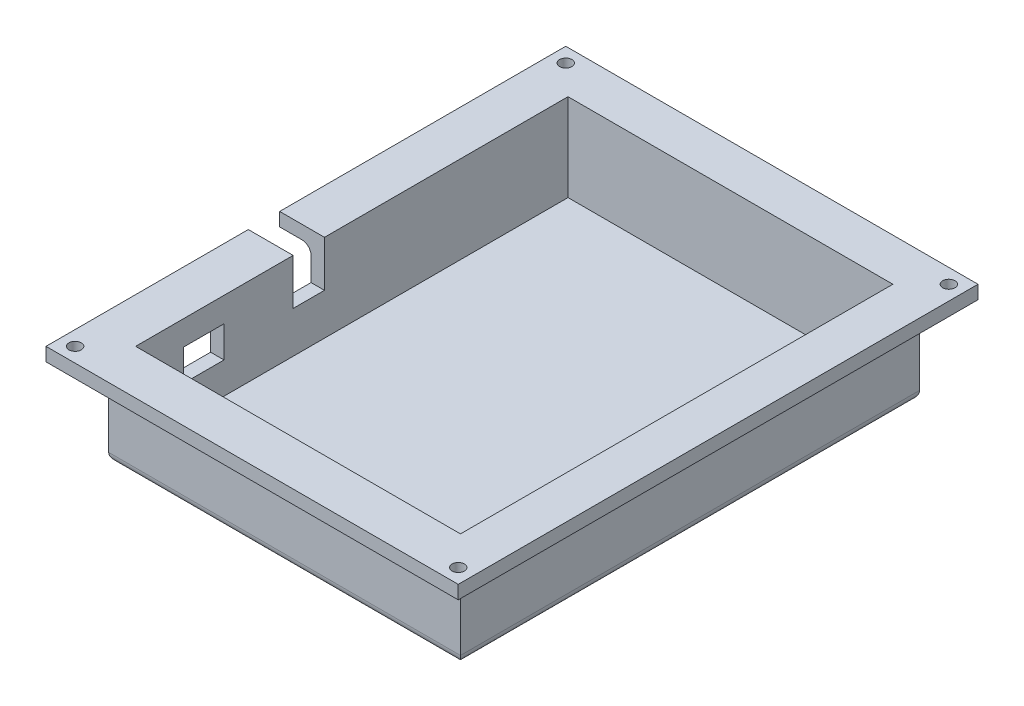
from build123d import *

# Parameters (mm, degrees)
SKETCH1_W           = 72.5
SKETCH1_H           = 96.5
BRACKETBASE_DEPTH   = 3
SKETCH3_W           = 78.5
SKETCH3_H           = 102.5
SKETCH3_W_2         = 72.5
SKETCH3_H_2         = 96.5
BRACKETWALLS_DEPTH  = 22.5
SKETCH4_W           = 7
SKETCH4_H           = 19.5
WIREHOLE_DEPTH      = 22.5
BRACKETFLANGE_DEPTH = 3
SKETCH7_R           = 1.375
MOUNTINGHOLES_DEPTH = 136.426179153
SKETCH8_W           = 9
SKETCH8_H           = 7
SWITCHHOLE_DEPTH    = 10
BOSS_EXTRUDE1_REACH = 112.68
SKETCH10_W          = 2.5
SKETCH10_H          = 7
BOSS_EXTRUDE2_DEPTH = 12.25
FILLET1_R           = 2
FILLET2_R           = 2
SKETCH11_W          = 7
SKETCH11_H          = 10.25
CUT_EXTRUDE1_DEPTH  = 10


with BuildPart() as part:
    # Sketch1 → bracketBase (new body)
    with BuildSketch(Plane(origin=(0, 0, 0), x_dir=(1, 0, 0), z_dir=(0, 1, 0))):
        with Locations((36.25, 48.25)):
            Rectangle(SKETCH1_W, SKETCH1_H)
    extrude(amount=BRACKETBASE_DEPTH)

    # Sketch3 → bracketWalls (add)
    with BuildSketch(Plane.XZ):
        with Locations((36.25, -48.25)):
            Rectangle(SKETCH3_W, SKETCH3_H)
        with Locations((36.25, -48.25)):
            Rectangle(SKETCH3_W_2, SKETCH3_H_2, mode=Mode.SUBTRACT)
    extrude(amount=-BRACKETWALLS_DEPTH)

    # Sketch4 → wireHole (cut)
    with BuildSketch(Plane.ZY.offset(-72.5)):
        with Locations((-38.65, 12.75)):
            Rectangle(SKETCH4_W, SKETCH4_H)
    wirehole = extrude(amount=-WIREHOLE_DEPTH, mode=Mode.SUBTRACT)

    # Sketch6 → bracketFlange (add)
    with BuildSketch(Plane(origin=(0, 22.5, 0), x_dir=(1, 0, 0), z_dir=(0, 1, 0))):
        Polygon((72.5, 96.5), (72.5, 42.15), (82, 42.15), (82, 106), (-10, 106), (-10, -10), (82, -10), (82, 35.15), (72.5, 35.15), (72.5, 0), (0, 0), (0, 96.5), align=None)
    extrude(amount=-BRACKETFLANGE_DEPTH)

    # Sketch7 → mountingHoles (cut, through all)
    with BuildSketch(Plane.XZ.offset(-19.5)):
        with Locations((78.75, -102.75)):
            Circle(SKETCH7_R)
        with Locations((78.75, 6.75)):
            Circle(SKETCH7_R)
        with Locations((-6.75, -102.75)):
            Circle(SKETCH7_R)
        with Locations((-6.75, 6.75)):
            Circle(SKETCH7_R)
    extrude(amount=-MOUNTINGHOLES_DEPTH, mode=Mode.SUBTRACT)

    # Mirror1: wireHole across plane
    add(wirehole.mirror(Plane(origin=(36, 0, 0), x_dir=(0, 0, 1), z_dir=(1, 0, 0))), mode=Mode.SUBTRACT)

    # Sketch8 → switchHole (cut)
    with BuildSketch(Plane.ZY.offset(3)):
        with Locations((-15.23, 13.5)):
            Rectangle(SKETCH8_W, SKETCH8_H)
    extrude(amount=-SWITCHHOLE_DEPTH, mode=Mode.SUBTRACT)

    # Sketch9 → Boss-Extrude1 (add, up to next)
    with BuildSketch(Plane(origin=(0, 0, -35.15), x_dir=(-1, 0, 0), z_dir=(0, 0, -1)), mode=Mode.PRIVATE) as boss_extrude1_sk1:
        Polygon((-72.5, 3), (-72.5, 22.5), (-82, 22.5), (-82, 19.5), (-75.5, 19.5), (-75.5, 3), align=None)
    boss_extrude1_tool1 = extrude(boss_extrude1_sk1.sketch, amount=BOSS_EXTRUDE1_REACH, mode=Mode.PRIVATE) - part.part
    add(boss_extrude1_tool1.solids().sort_by_distance((75.1875, 14.8125, -35.15))[0])

    # Sketch10 → Boss-Extrude2 (add)
    with BuildSketch(Plane.XZ):
        with Locations((-1.75, -38.65)):
            Rectangle(SKETCH10_W, SKETCH10_H)
    extrude(amount=-BOSS_EXTRUDE2_DEPTH)

    # Fillet1
    fillet1_edges = [part.edges().sort_by_distance(p)[0] for p in [
        (-3, 19.5, -70.825),
        (36.25, 19.5, -99.5),
        (75.5, 19.5, -48.25),
        (36.25, 19.5, 3),
        (-3, 19.5, -16.075),
    ]]
    fillet(fillet1_edges, radius=FILLET1_R)

    # Fillet2
    fillet2_edges = [part.edges().sort_by_distance(p)[0] for p in [
        (36.25, 0, 3),
        (75.5, 0, -48.25),
        (36.25, 0, -99.5),
        (-3, 0, -48.25),
    ]]
    fillet(fillet2_edges, radius=FILLET2_R)

    # Sketch11 → Cut-Extrude1 (cut)
    with BuildSketch(Plane.ZY.offset(0.5)):
        with Locations((-38.65, 17.375)):
            Rectangle(SKETCH11_W, SKETCH11_H)
    extrude(amount=-CUT_EXTRUDE1_DEPTH, mode=Mode.SUBTRACT)


solid = part.part
